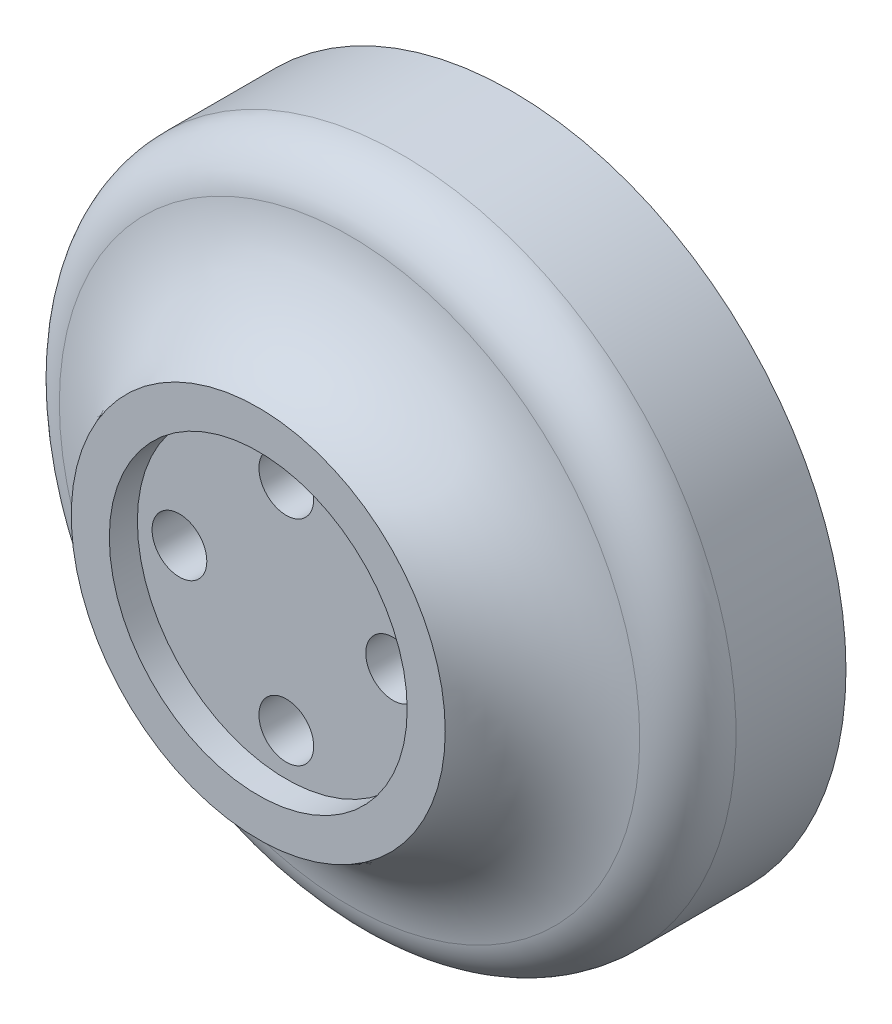
from build123d import *

# Parameters (mm, degrees)
SKETCH1_R           = 25
BOSS_EXTRUDE1_DEPTH = 12
BOSS_EXTRUDE2_START = 12
SKETCH2_R           = 14
BOSS_EXTRUDE2_DEPTH = 7
CUT_EXTRUDE1_START  = 19
SKETCH3_R           = 11.15
CUT_EXTRUDE1_DEPTH  = 2.1
FILLET1_R           = 10
FILLET2_R           = 4
SKETCH4_R           = 11
BOSS_EXTRUDE3_DEPTH = 8
CUT_EXTRUDE2_START  = 16.9
SKETCH5_R           = 2.05
CUT_EXTRUDE2_DEPTH  = 9
SKETCH6_R           = 2.05
CUT_EXTRUDE3_DEPTH  = 9


with BuildPart() as part:
    # Sketch1 → Boss-Extrude1 (new body)
    with BuildSketch(Plane.XY):
        Circle(SKETCH1_R)
    extrude(amount=BOSS_EXTRUDE1_DEPTH)

    # Sketch2 → Boss-Extrude2 (add)
    with BuildSketch(Plane.XY.offset(BOSS_EXTRUDE2_START)):
        Circle(SKETCH2_R)
    extrude(amount=BOSS_EXTRUDE2_DEPTH)

    # Sketch3 → Cut-Extrude1 (cut)
    with BuildSketch(Plane.XY.offset(CUT_EXTRUDE1_START)):
        Circle(SKETCH3_R)
    extrude(amount=-CUT_EXTRUDE1_DEPTH, mode=Mode.SUBTRACT)

    # Fillet1
    # the kernel refuses this fillet: 10 mm, written as the material it adds along each edge
    with BuildSketch(Plane(origin=(0, 0, 12), x_dir=(1, 0, 0), z_dir=(0, -1, 0))) as fillet1_piece_1:
        with BuildLine():
            CenterArc((23.539392014, 10), FILLET1_R, 197.457603124, 72.542396876)
            Line((14, 7), (13.80921216, 6.94))
            ThreePointArc((13.80921216, 6.94), (13.8, 3.5), (13.8, 0))
            Line((13.8, 0), (14, -0.2))
            Line((14, -0.2), (23.539392014, -0.2))
            Line((23.539392014, -0.2), (23.539392014, 0))
        make_face()
    revolve(axis=Axis((0, 0, 12), (0, 0, 1)))

    # Fillet2
    fillet2_edges = [part.edges().sort_by_distance(p)[0] for p in [
        (-25, 0, 12),
    ]]
    fillet(fillet2_edges, radius=FILLET2_R)

    # Sketch4 → Boss-Extrude3 (add)
    with BuildSketch(Plane.XY):
        Circle(SKETCH4_R)
    extrude(amount=-BOSS_EXTRUDE3_DEPTH)

    # Sketch5 → Cut-Extrude2 (cut)
    with BuildSketch(Plane.XY.offset(CUT_EXTRUDE2_START)):
        with Locations((0, 8)):
            Circle(SKETCH5_R)
        with Locations((8, 0)):
            Circle(SKETCH5_R)
        with Locations((0, -8)):
            Circle(SKETCH5_R)
        with Locations((-8, 0)):
            Circle(SKETCH5_R)
    extrude(amount=-CUT_EXTRUDE2_DEPTH, mode=Mode.SUBTRACT)

    # Sketch6 → Cut-Extrude3 (cut)
    with BuildSketch(Plane.XY):
        with Locations((0, 18)):
            Circle(SKETCH6_R)
        with Locations((18, 0)):
            Circle(SKETCH6_R)
        with Locations((0, -18)):
            Circle(SKETCH6_R)
        with Locations((-18, 0)):
            Circle(SKETCH6_R)
    extrude(amount=CUT_EXTRUDE3_DEPTH, mode=Mode.SUBTRACT)


solid = part.part
